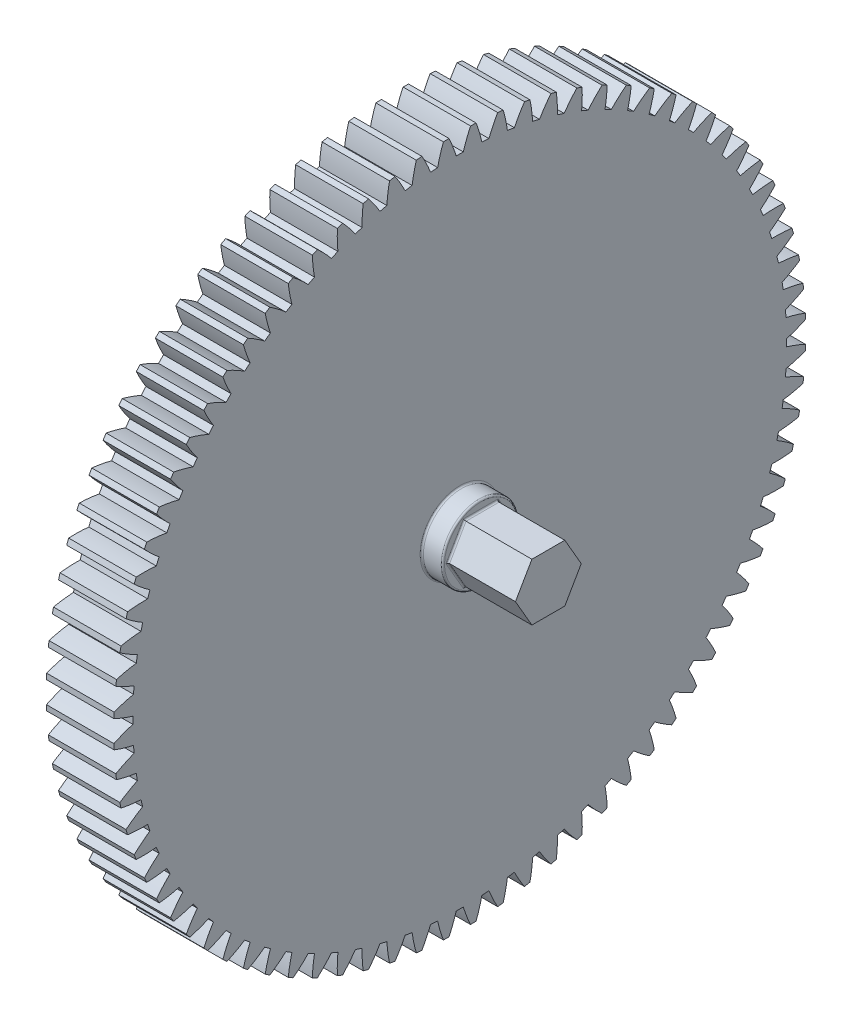
from build123d import *

# Parameters (mm, degrees)
BASPROSKE_W             = 8
BASPROSKE_H             = 41
TOOTHCUT_DEPTH          = 59.532042507
TEETHCUTS_COUNT         = 80
TEETHCUTS_ANGLE         = 355.5
BORSKE_R                = 0.4
BORE_DEPTH              = 50.0000508
CROQUIS1_R              = 4.5
SALIENTE_EXTRUIR1_DEPTH = 2.5
SALIENTE_EXTRUIR2_DEPTH = 8
REDONDEO1_R             = 0.2


with BuildPart() as part:
    # BasProSke → Base-Revolve (revolve)
    with BuildSketch(Plane(origin=(0, 0, 0), x_dir=(1, 0, 0), z_dir=(0, 1, 0))):
        with Locations((4, 20.5)):
            Rectangle(BASPROSKE_W, BASPROSKE_H)
    revolve(axis=Axis((-10, 0, 0), (1, 0, 0)))

    # TooCutSke → ToothCut (cut, through all)
    with BuildSketch(Plane(origin=(0, 0, 0), x_dir=(0, 0, -1), z_dir=(1, 0, 0))):
        with BuildLine():
            ThreePointArc((0.420555483, 38.74671772), (0, 38.749), (-0.420555483, 38.74671772))
            ThreePointArc((-0.420555483, 38.74671772), (-0.81345102, 39.892387293), (-1.291883564, 41.005054347))
            ThreePointArc((-1.291883564, 41.005054347), (0, 41.0254), (1.291883564, 41.005054347))
            ThreePointArc((1.291883564, 41.005054347), (0.81345102, 39.892387293), (0.420555483, 38.74671772))
        make_face()
    toothcut = extrude(amount=TOOTHCUT_DEPTH, mode=Mode.SUBTRACT)

    # TeethCuts: ToothCut ×80 about axis
    teethcuts_axis = Axis((-10, 0, 0), (1, 0, 0))
    for i in range(1, TEETHCUTS_COUNT):
        add(toothcut.rotate(teethcuts_axis, i * TEETHCUTS_ANGLE / (TEETHCUTS_COUNT - 1)), mode=Mode.SUBTRACT)

    # BorSke → Bore (cut, symmetric)
    with BuildSketch(Plane(origin=(0, 0, 0), x_dir=(0, 0, -1), z_dir=(1, 0, 0))):
        Circle(BORSKE_R)
    extrude(amount=BORE_DEPTH, both=True, mode=Mode.SUBTRACT)

    # Croquis1 → Saliente-Extruir1 (add)
    with BuildSketch(Plane(origin=(8, 0, 0), x_dir=(0, 0, -1), z_dir=(1, 0, 0))):
        Circle(CROQUIS1_R)
    extrude(amount=SALIENTE_EXTRUIR1_DEPTH)

    # Croquis2 → Saliente-Extruir2 (add)
    with BuildSketch(Plane(origin=(10.5, 0, 0), x_dir=(0, 0, -1), z_dir=(1, 0, 0))):
        Polygon((3.9, 0), (1.95, 3.377499075), (-1.95, 3.377499075), (-3.9, 0), (-1.95, -3.377499075), (1.95, -3.377499075), align=None)
    extrude(amount=SALIENTE_EXTRUIR2_DEPTH)

    # Redondeo1
    redondeo1_edges = [part.edges().sort_by_distance(p)[0] for p in [
        (10.5, 0, 4.5),
        (10.5, 1.688749537, -2.925),
        (10.5, 3.377499075, 0),
        (10.5, 1.688749537, 2.925),
        (10.5, -1.688749537, 2.925),
        (10.5, -3.377499075, 0),
        (10.5, -1.688749537, -2.925),
        (8, 0, 4.5),
    ]]
    fillet(redondeo1_edges, radius=REDONDEO1_R)


solid = part.part
